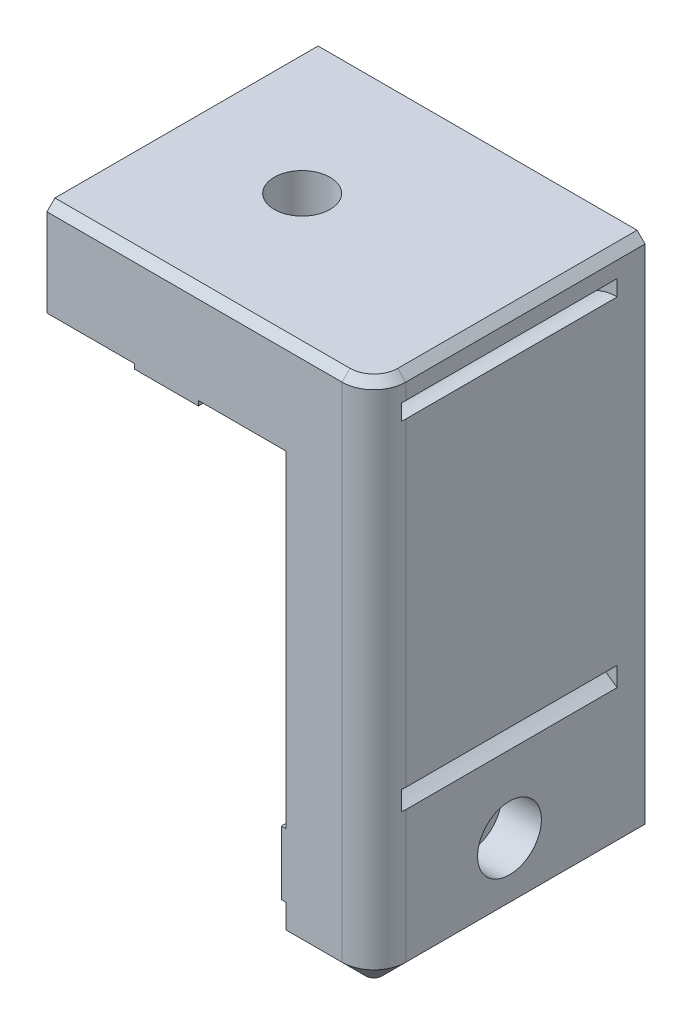
from build123d import *

# Parameters (mm, degrees)
SKETCH2_W           = 11
SKETCH2_H           = 34
BOSS_EXTRUDE1_DEPTH = 67
SKETCH3_W           = 34
SKETCH3_H           = 12
BOSS_EXTRUDE2_DEPTH = 30
SKETCH10_W          = 8
SKETCH10_H          = 0.6
SKETCH10_W_2        = 0.6
SKETCH10_H_2        = 8
BOSS_EXTRUDE3_DEPTH = 34
CUT_SWEEP1_START    = -13.5
CUT_SWEEP1_DEPTH    = 27
FILLET1_R           = 4
SKETCH7_R           = 2.25
CUT_EXTRUDE1_DEPTH  = 78.706177469
SKETCH8_R           = 2.25
CUT_EXTRUDE2_DEPTH  = 81.367904146
CHAMFER1_SIZE       = 3
CHAMFER2_SIZE       = 1
SKETCH9_R           = 3.5
CUT_EXTRUDE3_DEPTH  = 6
SKETCH11_R          = 4
CUT_EXTRUDE4_DEPTH  = 5


# Read off the part's stored shape, not the designer's step: Cut-Sweep1
with BuildPart() as part:
    # Sketch2 → Boss-Extrude1 (new body)
    with BuildSketch(Plane(origin=(0, 0, 0), x_dir=(1, 0, 0), z_dir=(0, 1, 0))):
        Rectangle(SKETCH2_W, SKETCH2_H)
    extrude(amount=BOSS_EXTRUDE1_DEPTH)

    # Sketch3 → Boss-Extrude2 (add)
    with BuildSketch(Plane.ZY.offset(5.5)):
        with Locations((0, 61)):
            Rectangle(SKETCH3_W, SKETCH3_H)
    extrude(amount=BOSS_EXTRUDE2_DEPTH)

    # Sketch10 → Boss-Extrude3 (add)
    with BuildSketch(Plane.XY.offset(17)):
        with Locations((-20.5, 54.7)):
            Rectangle(SKETCH10_W, SKETCH10_H)
        with Locations((-5.8, 10)):
            Rectangle(SKETCH10_W_2, SKETCH10_H_2)
    extrude(amount=-BOSS_EXTRUDE3_DEPTH)

    # Cut-Sweep1 outline → Cut-Sweep1 (cut)
    with BuildSketch(Plane.XY.offset(CUT_SWEEP1_START)):
        with BuildLine():
            ThreePointArc((5.5, 22), (1.083592135, 27.291796068), (-0.5, 34))
            Line((-0.5, 34), (-0.5, 56))
            ThreePointArc((-0.5, 56), (1.257359313, 60.242640687), (5.5, 62))
            Line((5.5, 62), (5.5, 64))
            ThreePointArc((5.5, 64), (-0.156854249, 61.656854249), (-2.5, 56))
            Line((-2.5, 56), (-2.5, 34))
            ThreePointArc((-2.5, 34), (-0.366068747, 25.753788749), (5.5, 19.577794898))
            Line((5.5, 19.577794898), (5.5, 22))
        make_face()
    extrude(amount=CUT_SWEEP1_DEPTH, mode=Mode.SUBTRACT)

    # Fillet1
    # the kernel refuses this fillet: 4 mm, written as the material it takes off along each edge
    with BuildSketch(Plane(origin=(5.5, -10, 17), x_dir=(0, 0, -1), z_dir=(0, 1, 0))) as fillet1_piece_1:
        with BuildLine():
            CenterArc((FILLET1_R, FILLET1_R), FILLET1_R, 180, 90)
            Line((0, FILLET1_R), (0, 0))
            Line((0, 0), (FILLET1_R, 0))
        make_face()
    extrude(amount=87, mode=Mode.SUBTRACT)

    # Sketch7 → Cut-Extrude1 (cut, through all)
    with BuildSketch(Plane(origin=(0, 67, 0), x_dir=(1, 0, 0), z_dir=(0, 1, 0))):
        with Locations(Location((-20.5, 0, 0), (0, 0, 270))):
            Circle(SKETCH7_R)
    extrude(amount=-CUT_EXTRUDE1_DEPTH, mode=Mode.SUBTRACT)

    # Sketch8 → Cut-Extrude2 (cut, through all)
    with BuildSketch(Plane(origin=(5.5, 0, 0), x_dir=(0, 0, -1), z_dir=(1, 0, 0))):
        with Locations((0, 10)):
            Circle(SKETCH8_R)
    extrude(amount=-CUT_EXTRUDE2_DEPTH, mode=Mode.SUBTRACT)

    # Chamfer1
    chamfer1_edges = [part.edges().sort_by_distance(p)[0] for p in [
        (-2, 0, 17),
        (5.5, 0, -2),
        (4.328427125, 0, 15.828427125),
    ]]
    chamfer(chamfer1_edges, length=CHAMFER1_SIZE)

    # Chamfer2
    chamfer2_edges = [part.edges().sort_by_distance(p)[0] for p in [
        (-17, 67, 17),
        (5.5, 67, -2),
        (4.328427125, 67, 15.828427125),
    ]]
    chamfer(chamfer2_edges, length=CHAMFER2_SIZE)

    # Sketch9 → Cut-Extrude3 (cut)
    with BuildSketch(Plane(origin=(0, 67, 0), x_dir=(1, 0, 0), z_dir=(0, 1, 0))):
        with Locations(Location((-20.5, 0, 0), (0, 0, 270))):
            Circle(SKETCH9_R)
    extrude(amount=-CUT_EXTRUDE3_DEPTH, mode=Mode.SUBTRACT)

    # Sketch11 → Cut-Extrude4 (cut)
    with BuildSketch(Plane(origin=(5.5, 0, 0), x_dir=(0, 0, -1), z_dir=(1, 0, 0))):
        with Locations((0, 10)):
            Circle(SKETCH11_R)
    extrude(amount=-CUT_EXTRUDE4_DEPTH, mode=Mode.SUBTRACT)


solid = part.part
